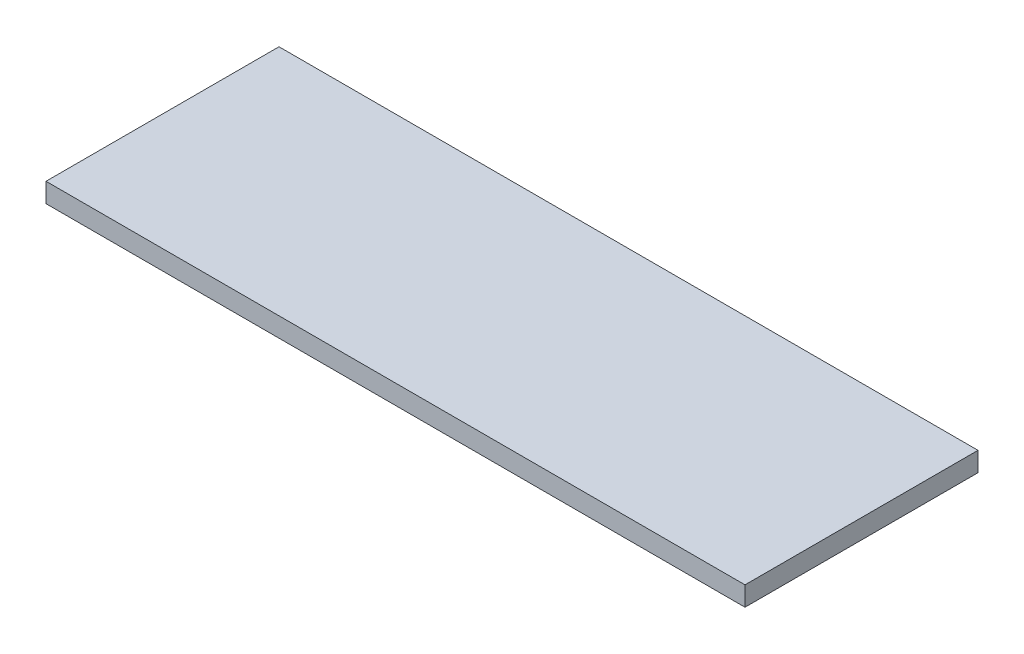
from build123d import *

# Parameters (mm, degrees)
SKETCH1_W           = 114.3
SKETCH1_H           = 38.1
BOSS_EXTRUDE1_DEPTH = 3.175


with BuildPart() as part:
    # Sketch1 → Boss-Extrude1 (new body)
    with BuildSketch(Plane(origin=(0, 0, 0), x_dir=(1, 0, 0), z_dir=(0, 1, 0))):
        with Locations((57.15, 19.05)):
            Rectangle(SKETCH1_W, SKETCH1_H)
    extrude(amount=BOSS_EXTRUDE1_DEPTH)


solid = part.part
